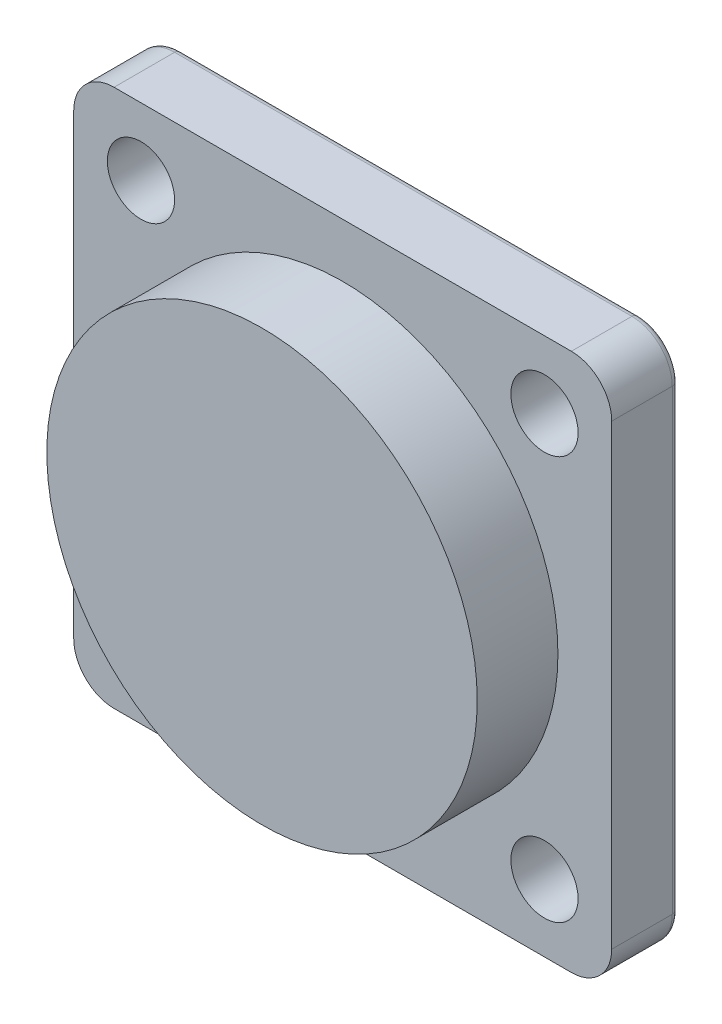
from build123d import *

# Parameters (mm, degrees)
SKETCH1_W           = 40
SKETCH1_H           = 40
SKETCH1_R           = 2.5
SKETCH1_R_2         = 16
BOSS_EXTRUDE1_DEPTH = 2.5
BOSS_EXTRUDE2_START = 2.5
SKETCH1_5_R         = 16
BOSS_EXTRUDE2_DEPTH = 6
FILLET1_R           = 0.5
FILLET2_R           = 3


with BuildPart() as part:
    # Sketch1 → Boss-Extrude1 (new, symmetric)
    # profile 1 of 2: a face of its own
    with BuildSketch(Plane.XY):
        Rectangle(SKETCH1_W, SKETCH1_H)
        with Locations((-15, -15)):
            Circle(SKETCH1_R, mode=Mode.SUBTRACT)
        with Locations((15, -15)):
            Circle(SKETCH1_R, mode=Mode.SUBTRACT)
        with Locations((15, 15)):
            Circle(SKETCH1_R, mode=Mode.SUBTRACT)
        with Locations((-15, 15)):
            Circle(SKETCH1_R, mode=Mode.SUBTRACT)
        Circle(SKETCH1_R_2, mode=Mode.SUBTRACT)
    # profile 2 of 2: a face of its own
    with BuildSketch(Plane.XY):
        Circle(SKETCH1_R_2)
    extrude(amount=BOSS_EXTRUDE1_DEPTH, both=True)

    # Sketch1<5> → Boss-Extrude2 (add)
    with BuildSketch(Plane.XY.offset(BOSS_EXTRUDE2_START)):
        Circle(SKETCH1_5_R)
    extrude(amount=BOSS_EXTRUDE2_DEPTH)

    # Fillet1
    fillet1_edges = [part.edges().sort_by_distance(p)[0] for p in [
        (0, -20, -2.5),
        (-20, 0, -2.5),
        (0, 20, -2.5),
        (20, 0, -2.5),
    ]]
    fillet(fillet1_edges, radius=FILLET1_R)

    # Fillet2
    # the kernel refuses this fillet: 3 mm, written as the material it takes off along each edge
    with BuildSketch(Plane(origin=(-17, 17, -2.5), x_dir=(-1, 0, 0), z_dir=(0, -1, 0))) as fillet2_piece_1:
        with BuildLine():
            CenterArc((2.5, -0.5), 0.5, 0, 90)
            Line((3, -0.5), (3, 0))
            Line((3, 0), (2.5, 0))
        make_face()
    revolve(axis=Axis((-17, 17, -2.5), (0, 0, -1)), revolution_arc=90, mode=Mode.SUBTRACT)
    with BuildSketch(Plane(origin=(-17, -17, -2.5), x_dir=(0, -1, 0), z_dir=(1, 0, 0))) as fillet2_piece_2:
        with BuildLine():
            CenterArc((2.5, -0.5), 0.5, 0, 90)
            Line((3, -0.5), (3, 0))
            Line((3, 0), (2.5, 0))
        make_face()
    revolve(axis=Axis((-17, -17, -2.5), (0, 0, -1)), revolution_arc=90, mode=Mode.SUBTRACT)
    with BuildSketch(Plane(origin=(17, 17, -2.5), x_dir=(0, 1, 0), z_dir=(-1, 0, 0))) as fillet2_piece_3:
        with BuildLine():
            CenterArc((2.5, -0.5), 0.5, 0, 90)
            Line((3, -0.5), (3, 0))
            Line((3, 0), (2.5, 0))
        make_face()
    revolve(axis=Axis((17, 17, -2.5), (0, 0, -1)), revolution_arc=90, mode=Mode.SUBTRACT)
    with BuildSketch(Plane(origin=(17, -17, -2.5), x_dir=(1, 0, 0), z_dir=(0, 1, 0))) as fillet2_piece_4:
        with BuildLine():
            CenterArc((2.5, -0.5), 0.5, 0, 90)
            Line((3, -0.5), (3, 0))
            Line((3, 0), (2.5, 0))
        make_face()
    revolve(axis=Axis((17, -17, -2.5), (0, 0, -1)), revolution_arc=90, mode=Mode.SUBTRACT)
    with BuildSketch(Plane(origin=(20, -20, 10), x_dir=(0, 1, 0), z_dir=(0, 0, -1)), Plane(origin=(-20, -20, 10), x_dir=(1, 0, 0), z_dir=(0, 0, -1)), Plane(origin=(-20, 20, -2.5), x_dir=(1, 0, 0), z_dir=(0, 0, 1)), Plane(origin=(20, 20, -2.5), x_dir=(0, -1, 0), z_dir=(0, 0, 1))) as fillet2_piece_5:
        with BuildLine():
            CenterArc((FILLET2_R, -FILLET2_R), FILLET2_R, 90, 90)
            Line((0, -FILLET2_R), (0, 0))
            Line((0, 0), (FILLET2_R, 0))
        make_face()
    extrude(amount=12.5, mode=Mode.SUBTRACT)


solid = part.part
